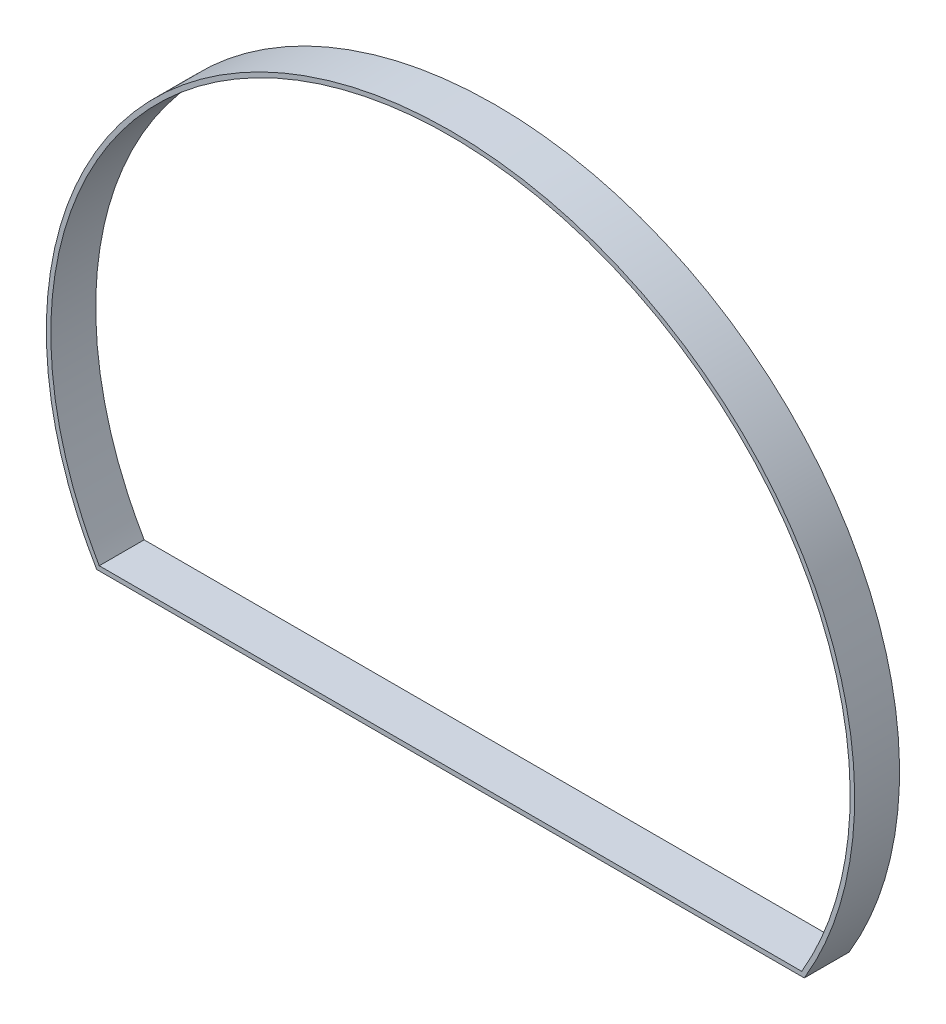
from build123d import *

# Parameters (mm, degrees)
BOSS_EXTRUDE1_DEPTH = 10


with BuildPart() as part:
    # Sketch1 → Boss-Extrude1 (new body)
    with BuildSketch(Plane.XY):
        with BuildLine():
            Line((-78.784725628, -40.410331754), (78.784725628, -40.410331754))
            add(Edge.make_bspline(
                [(78.784725628, -40.410331754), (80.657626123, -37.260414577), (83.991028991, -30.682161267), (88.745812871, -16.88837629), (91.008188459, 1.232559437), (87.616622094, 22.887830728), (78.358178564, 43.004998748), (63.858419685, 60.233707267), (45.094873424, 73.426424095), (23.32439292, 81.707910519), (0, 84.530547109), (-23.32439292, 81.707910519), (-45.094873424, 73.426424095), (-63.858419685, 60.233707267), (-78.358178564, 43.004998748), (-87.616622094, 22.887830728), (-91.008188459, 1.232559437), (-88.745812871, -16.88837629), (-83.991028991, -30.682161267), (-80.657626123, -37.260414577), (-78.784725628, -40.410331754)],
                knots=[-0.504194498, -0.504194498, -0.504194498, -0.504194498, -0.374507571, -0.244820645, 0.014553208, 0.273927061, 0.533300914, 0.792674768, 1.052048621, 1.311422474, 1.570796327, 1.83017018, 2.089544033, 2.348917886, 2.608291739, 2.867665592, 3.127039445, 3.386413298, 3.516100225, 3.645787151, 3.645787151, 3.645787151, 3.645787151], degree=3))
        make_face()
        with BuildLine():
            Line((-78.213583193, -39.410331754), (78.213583193, -39.410331754))
            add(Edge.make_bspline(
                [(78.213583193, -39.410331754), (149.600119251, 82.589668246), (0, 82.589668246), (-149.600119251, 82.589668246), (-78.213583193, -39.410331754)],
                knots=[5.785739631, 5.785739631, 5.785739631, 7.853981634, 7.853981634, 9.922223637, 9.922223637, 9.922223637], degree=2, weights=[1, 0.511281553, 1, 0.511281553, 1]))
        make_face(mode=Mode.SUBTRACT)
    extrude(amount=BOSS_EXTRUDE1_DEPTH)


solid = part.part
